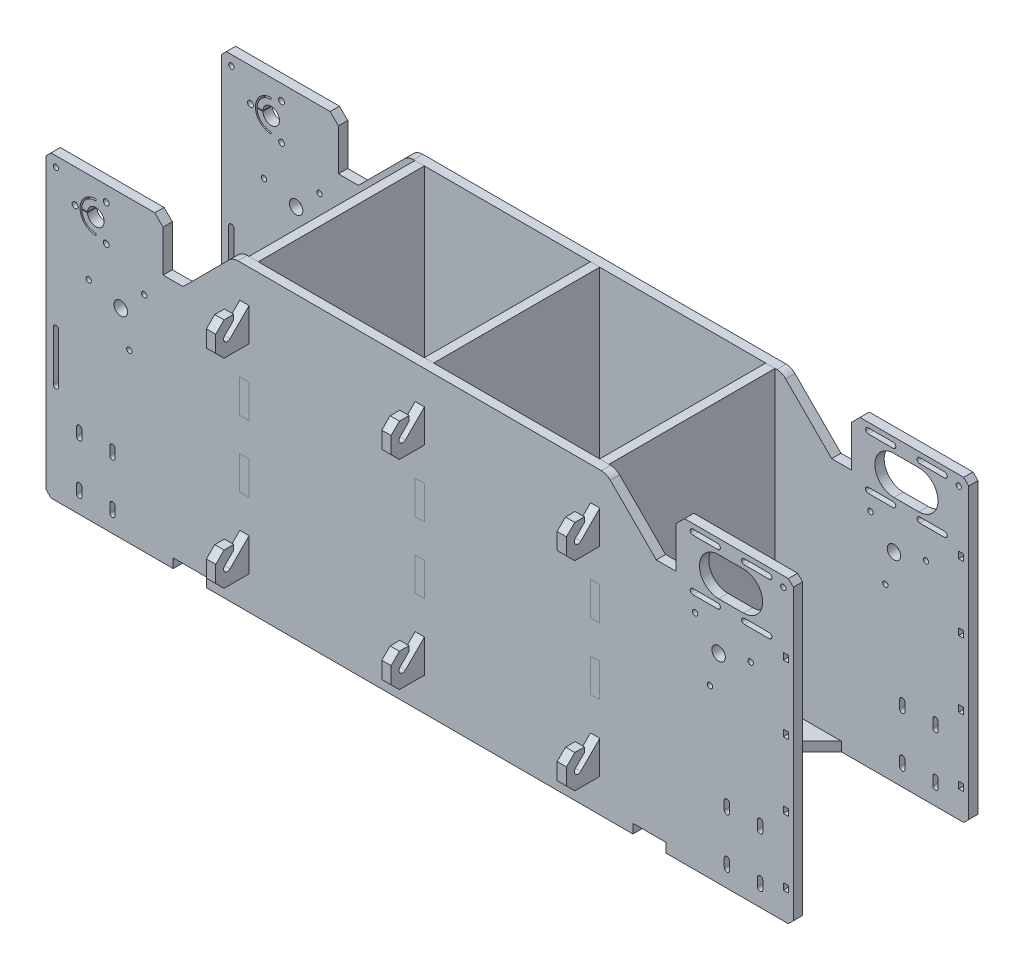
from build123d import *

# Parameters (mm, degrees)
SKETCH1_W           = 5.6
SKETCH1_H           = 20
BOSS_EXTRUDE1_DEPTH = 5.6
BOSS_EXTRUDE5_DEPTH = 5.6
CHAMFER1_SIZE       = 5
CUT_EXTRUDE1_DEPTH  = 7
LPATTERN2_COUNT     = 3
LPATTERN2_PITCH     = 105.6
BOSS_EXTRUDE6_DEPTH = 5.6
BOSS_EXTRUDE7_DEPTH = 5.6
SKETCH7_R           = 1.6
SKETCH7_R_2         = 4.1
SKETCH7_R_3         = 6.5
CUT_EXTRUDE3_DEPTH  = 5.6
LPATTERN4_COUNT     = 2
LPATTERN4_PITCH     = 105.6
CUT_EXTRUDE4_DEPTH  = 10
SKETCH14_R          = 1.75
CUT_EXTRUDE11_DEPTH = 5.6
CUT_EXTRUDE5_DEPTH  = 10
SKETCH10_R          = 4.05
SKETCH10_R_2        = 1.6
CUT_EXTRUDE6_DEPTH  = 10
SKETCH11_W          = 3
SKETCH11_H          = 4
CUT_EXTRUDE7_DEPTH  = 5.6
SKETCH12_R          = 1.6
CUT_EXTRUDE8_DEPTH  = 5.6
CHAMFER2_SIZE       = 3
CHAMFER3_SIZE       = 3
CUT_EXTRUDE9_DEPTH  = 5.6


with BuildPart() as part:
    # Sketch1 → Boss-Extrude1 (new body)
    with BuildSketch(Plane.XY):
        Polygon((0, 0), (76.6, 0), (76.6, 5.6), (96.6, 5.6), (96.6, 0), (353.4, 0), (353.4, 5.6), (373.4, 5.6), (373.4, 0), (450, 0), (450, 180), (0, 180), align=None)
        with Locations((330.6, 150)):
            Rectangle(SKETCH1_W, SKETCH1_H, mode=Mode.SUBTRACT)
        with Locations((330.6, 110)):
            Rectangle(SKETCH1_W, SKETCH1_H, mode=Mode.SUBTRACT)
        with Locations((330.6, 70)):
            Rectangle(SKETCH1_W, SKETCH1_H, mode=Mode.SUBTRACT)
        with Locations((330.6, 30)):
            Rectangle(SKETCH1_W, SKETCH1_H, mode=Mode.SUBTRACT)
        with Locations((119.4, 30)):
            Rectangle(SKETCH1_W, SKETCH1_H, mode=Mode.SUBTRACT)
        with Locations((119.4, 70)):
            Rectangle(SKETCH1_W, SKETCH1_H, mode=Mode.SUBTRACT)
        with Locations((119.4, 110)):
            Rectangle(SKETCH1_W, SKETCH1_H, mode=Mode.SUBTRACT)
        with Locations((119.4, 150)):
            Rectangle(SKETCH1_W, SKETCH1_H, mode=Mode.SUBTRACT)
        with Locations((225, 150)):
            Rectangle(SKETCH1_W, SKETCH1_H, mode=Mode.SUBTRACT)
        with Locations((225, 110)):
            Rectangle(SKETCH1_W, SKETCH1_H, mode=Mode.SUBTRACT)
        with Locations((225, 70)):
            Rectangle(SKETCH1_W, SKETCH1_H, mode=Mode.SUBTRACT)
        with Locations((225, 30)):
            Rectangle(SKETCH1_W, SKETCH1_H, mode=Mode.SUBTRACT)
    extrude(amount=BOSS_EXTRUDE1_DEPTH)

    # Sketch8 → Cut-Extrude4 (cut)
    with BuildSketch(Plane.XY.offset(5.6)):
        with BuildLine():
            Line((420, 171.5), (405, 171.5))
            ThreePointArc((405, 171.5), (393.5, 160), (405, 148.5))
            Line((405, 148.5), (420, 148.5))
            ThreePointArc((420, 148.5), (431.5, 160), (420, 171.5))
        make_face()
        with BuildLine():
            Line((435.5, 146.1), (420.5, 146.1))
            ThreePointArc((420.5, 146.1), (418.9, 144.5), (420.5, 142.9))
            Line((420.5, 142.9), (435.5, 142.9))
            ThreePointArc((435.5, 142.9), (437.1, 144.5), (435.5, 146.1))
        make_face()
        with BuildLine():
            Line((435.5, 177.1), (420.5, 177.1))
            ThreePointArc((420.5, 177.1), (418.9, 175.5), (420.5, 173.9))
            Line((420.5, 173.9), (435.5, 173.9))
            ThreePointArc((435.5, 173.9), (437.1, 175.5), (435.5, 177.1))
        make_face()
        with BuildLine():
            Line((404.5, 177.1), (389.5, 177.1))
            ThreePointArc((389.5, 177.1), (387.9, 175.5), (389.5, 173.9))
            Line((389.5, 173.9), (404.5, 173.9))
            ThreePointArc((404.5, 173.9), (406.1, 175.5), (404.5, 177.1))
        make_face()
        with BuildLine():
            ThreePointArc((25.00625, 159.750078137), (35, 160), (25.00625, 160.249921863))
            ThreePointArc((25.00625, 160.249921863), (25.003125244, 160.249980465), (25, 160.25))
            Line((25, 160.25), (21.503677266, 160.25))
            ThreePointArc((21.503677266, 160.25), (24.078640359, 166.098155459), (30, 168.5))
            Line((30, 168.5), (30, 169.5))
            ThreePointArc((30, 169.5), (20.5, 160), (30, 150.5))
            Line((30, 150.5), (30, 151.5))
            ThreePointArc((30, 151.5), (24.078640359, 153.901844541), (21.503677266, 159.75))
            Line((21.503677266, 159.75), (25, 159.75))
            ThreePointArc((25, 159.75), (25.003125244, 159.750019535), (25.00625, 159.750078137))
        make_face()
        with BuildLine():
            Line((404.5, 142.9), (389.5, 142.9))
            ThreePointArc((389.5, 142.9), (387.9, 144.5), (389.5, 146.1))
            Line((389.5, 146.1), (404.5, 146.1))
            ThreePointArc((404.5, 146.1), (406.1, 144.5), (404.5, 142.9))
        make_face()
    extrude(amount=-CUT_EXTRUDE4_DEPTH, mode=Mode.SUBTRACT)

    # Sketch14 → Cut-Extrude11 (cut)
    with BuildSketch(Plane(origin=(0, 0, 0), x_dir=(-1, 0, 0), z_dir=(0, 0, -1))):
        with Locations((-17.5, 160)):
            Circle(SKETCH14_R)
        with Locations((-36.25, 149.174682453)):
            Circle(SKETCH14_R)
        with Locations((-36.25, 170.825317547)):
            Circle(SKETCH14_R)
    extrude(amount=-CUT_EXTRUDE11_DEPTH, mode=Mode.SUBTRACT)

    # Sketch9 → Cut-Extrude5 (cut)
    with BuildSketch(Plane(origin=(0, 0, 0), x_dir=(-1, 0, 0), z_dir=(0, 0, -1))):
        with BuildLine():
            Line((-384.5, 180), (-335.222391823, 180))
            Line((-335.222391823, 180), (-334.460765152, 180))
            ThreePointArc((-334.460765152, 180), (-337.371477018, 179.341328219), (-339.838266899, 177.661733101))
            Line((-339.838266899, 177.661733101), (-367.5, 150))
            Line((-367.5, 150), (-379.5, 150))
            Line((-379.5, 150), (-379.5, 175))
            Line((-379.5, 175), (-384.5, 180))
        make_face()
    cut_extrude5 = extrude(amount=-CUT_EXTRUDE5_DEPTH, mode=Mode.SUBTRACT)

    # Mirror4: Cut-Extrude5 across plane
    add(cut_extrude5.mirror(Plane.ZY.offset(-225)), mode=Mode.SUBTRACT)

    # Sketch10 → Cut-Extrude6 (cut)
    with BuildSketch(Plane(origin=(0, 0, 0), x_dir=(-1, 0, 0), z_dir=(0, 0, -1))):
        with Locations((-405, 120)):
            Circle(SKETCH10_R)
        with Locations((-390.857864376, 134.142135624)):
            Circle(SKETCH10_R_2)
        with Locations((-399.823619098, 100.681483474)):
            Circle(SKETCH10_R_2)
        with Locations((-424.318516526, 125.176380902)):
            Circle(SKETCH10_R_2)
    cut_extrude6 = extrude(amount=-CUT_EXTRUDE6_DEPTH, mode=Mode.SUBTRACT)

    # Sketch11 → Cut-Extrude7 (cut)
    with BuildSketch(Plane.XY.offset(5.6)):
        with Locations((445.5, 138)):
            Rectangle(SKETCH11_W, SKETCH11_H)
        with Locations((445.5, 98)):
            Rectangle(SKETCH11_W, SKETCH11_H)
        with Locations((445.5, 58)):
            Rectangle(SKETCH11_W, SKETCH11_H)
        with Locations((445.5, 18)):
            Rectangle(SKETCH11_W, SKETCH11_H)
    extrude(amount=-CUT_EXTRUDE7_DEPTH, mode=Mode.SUBTRACT)

    # Sketch12 → Cut-Extrude8 (cut)
    with BuildSketch(Plane.XY.offset(5.6)):
        with Locations((444, 174)):
            Circle(SKETCH12_R)
        with Locations((6, 174)):
            Circle(SKETCH12_R)
        with BuildLine():
            Line((7.6, 90), (7.6, 60))
            ThreePointArc((7.6, 60), (6, 58.4), (4.4, 60))
            Line((4.4, 60), (4.4, 90))
            ThreePointArc((4.4, 90), (6, 91.6), (7.6, 90))
        make_face()
    extrude(amount=-CUT_EXTRUDE8_DEPTH, mode=Mode.SUBTRACT)

    # Chamfer2
    chamfer2_edges = [part.edges().sort_by_distance(p)[0] for p in [
        (450, 180, 2.8),
        (0, 180, 2.8),
    ]]
    chamfer(chamfer2_edges, length=CHAMFER2_SIZE)

    # Chamfer3
    chamfer3_edges = [part.edges().sort_by_distance(p)[0] for p in [
        (450, 0, 2.8),
        (0, 0, 2.8),
    ]]
    chamfer(chamfer3_edges, length=CHAMFER3_SIZE)

    # Sketch13 → Cut-Extrude9 (cut)
    with BuildSketch(Plane(origin=(0, 0, 0), x_dir=(-1, 0, 0), z_dir=(0, 0, -1))):
        with BuildLine():
            Line((-431.6, 40), (-431.6, 45))
            ThreePointArc((-431.6, 45), (-430, 46.6), (-428.4, 45))
            Line((-428.4, 45), (-428.4, 40))
            ThreePointArc((-428.4, 40), (-430, 38.4), (-431.6, 40))
        make_face()
        with BuildLine():
            Line((-411.6, 40), (-411.6, 45))
            ThreePointArc((-411.6, 45), (-410, 46.6), (-408.4, 45))
            Line((-408.4, 45), (-408.4, 40))
            ThreePointArc((-408.4, 40), (-410, 38.4), (-411.6, 40))
        make_face()
        with BuildLine():
            Line((-411.6, 10), (-411.6, 15))
            ThreePointArc((-411.6, 15), (-410, 16.6), (-408.4, 15))
            Line((-408.4, 15), (-408.4, 10))
            ThreePointArc((-408.4, 10), (-410, 8.4), (-411.6, 10))
        make_face()
        with BuildLine():
            Line((-431.6, 10), (-431.6, 15))
            ThreePointArc((-431.6, 15), (-430, 16.6), (-428.4, 15))
            Line((-428.4, 15), (-428.4, 10))
            ThreePointArc((-428.4, 10), (-430, 8.4), (-431.6, 10))
        make_face()
        with BuildLine():
            Line((-18.4, 40), (-18.4, 45))
            ThreePointArc((-18.4, 45), (-20, 46.6), (-21.6, 45))
            Line((-21.6, 45), (-21.6, 40))
            ThreePointArc((-21.6, 40), (-20, 38.4), (-18.4, 40))
        make_face()
        with BuildLine():
            Line((-38.4, 40), (-38.4, 45))
            ThreePointArc((-38.4, 45), (-40, 46.6), (-41.6, 45))
            Line((-41.6, 45), (-41.6, 40))
            ThreePointArc((-41.6, 40), (-40, 38.4), (-38.4, 40))
        make_face()
        with BuildLine():
            Line((-38.4, 10), (-38.4, 15))
            ThreePointArc((-38.4, 15), (-40, 16.6), (-41.6, 15))
            Line((-41.6, 15), (-41.6, 10))
            ThreePointArc((-41.6, 10), (-40, 8.4), (-38.4, 10))
        make_face()
        with BuildLine():
            Line((-18.4, 10), (-18.4, 15))
            ThreePointArc((-18.4, 15), (-20, 16.6), (-21.6, 15))
            Line((-21.6, 15), (-21.6, 10))
            ThreePointArc((-21.6, 10), (-20, 8.4), (-18.4, 10))
        make_face()
    extrude(amount=-CUT_EXTRUDE9_DEPTH, mode=Mode.SUBTRACT)

    # Mirror8: Cut-Extrude6 across plane
    add(cut_extrude6.mirror(Plane.ZY.offset(-225)), mode=Mode.SUBTRACT)


with BuildPart() as body_2:
    # Sketch2 → Boss-Extrude5 (new body)
    with BuildSketch(Plane(origin=(116.6, 0, 0), x_dir=(0, 0, -1), z_dir=(1, 0, 0))):
        Polygon((-5.6, 180), (-105.6, 180), (-105.6, 160), (-131.2, 160), (-131.2, 140), (-105.6, 140), (-105.6, 120), (-111.2, 120), (-111.2, 100), (-105.6, 100), (-105.6, 80), (-111.2, 80), (-111.2, 60), (-105.6, 60), (-105.6, 40), (-131.2, 40), (-131.2, 20), (-105.6, 20), (-105.6, 0), (-87, 0), (-87, 5.6), (-67, 5.6), (-67, 0), (-45.6, 0), (-45.6, 5.6), (-25.6, 5.6), (-25.6, 0), (-5.6, 0), (-5.6, 20), (0, 20), (0, 40), (-5.6, 40), (-5.6, 60), (0, 60), (0, 80), (-5.6, 80), (-5.6, 100), (0, 100), (0, 120), (-5.6, 120), (-5.6, 140), (0, 140), (0, 160), (-5.6, 160), align=None)
    extrude(amount=BOSS_EXTRUDE5_DEPTH)

    # Chamfer1
    chamfer1_edges = [body_2.edges().sort_by_distance(p)[0] for p in [
        (119.4, 20, 131.2),
        (119.4, 40, 131.2),
        (119.4, 140, 131.2),
        (119.4, 160, 131.2),
    ]]
    chamfer(chamfer1_edges, length=CHAMFER1_SIZE)

    # Sketch3 → Cut-Extrude1 (cut)
    with BuildSketch(Plane.ZY.offset(-116.6)):
        with BuildLine():
            Line((125.790990258, 151.590990258), (120.381980515, 157))
            Line((120.381980515, 157), (120.381980515, 160))
            Line((120.381980515, 160), (111.018019485, 160))
            Line((111.018019485, 160), (122.609009742, 148.409009742))
            ThreePointArc((122.609009742, 148.409009742), (125.790990258, 148.409009742), (125.790990258, 151.590990258))
        make_face()
        with BuildLine():
            Line((125.790990258, 31.590990258), (120.381980515, 37))
            Line((120.381980515, 37), (120.381980515, 40))
            Line((120.381980515, 40), (111.018019485, 40))
            Line((111.018019485, 40), (122.609009742, 28.409009742))
            ThreePointArc((122.609009742, 28.409009742), (125.790990258, 28.409009742), (125.790990258, 31.590990258))
        make_face()
    extrude(amount=-CUT_EXTRUDE1_DEPTH, mode=Mode.SUBTRACT)


with BuildPart() as lpattern2_1:
    # LPattern2: pattern copy
    add(body_2.part.moved(Location(Vector(1, 0, 0) * (1 * LPATTERN2_PITCH))))


with BuildPart() as lpattern2_2:
    # LPattern2: pattern copy
    add(body_2.part.moved(Location(Vector(1, 0, 0) * (2 * LPATTERN2_PITCH))))


with BuildPart() as body_5:
    # Sketch4 → Boss-Extrude6 (new body)
    with BuildSketch(Plane.XZ):
        Polygon((116.6, 5.6), (96.6, 5.6), (96.6, 0), (76.6, 0), (76.6, 5.6), (116.6, 45.6), (119.4, 45.6), (119.4, 25.6), (116.6, 25.6), align=None)
    extrude(amount=-BOSS_EXTRUDE6_DEPTH)


with BuildPart() as body_6:
    # Mirror3: mirrored copy
    add(body_5.part.mirror(Plane.ZY.offset(-225)))


with BuildPart() as body_7:
    # Sketch5 → Boss-Extrude7 (new body)
    with BuildSketch(Plane.XZ):
        Polygon((122.2, 105.6), (122.2, 87), (119.4, 87), (119.4, 67), (122.2, 67), (122.2, 45.6), (119.4, 45.6), (119.4, 25.6), (122.2, 25.6), (122.2, 5.6), (222.2, 5.6), (222.2, 25.6), (225, 25.6), (225, 45.6), (222.2, 45.6), (222.2, 67), (225, 67), (225, 87), (222.2, 87), (222.2, 105.6), align=None)
    extrude(amount=-BOSS_EXTRUDE7_DEPTH)

    # Sketch7 → Cut-Extrude3 (cut)
    with BuildSketch(Plane.XZ):
        with Locations((195.2, 68.1)):
            Circle(SKETCH7_R)
        with Locations((172.2, 91.1)):
            Circle(SKETCH7_R)
        with Locations((183.025317547, 72.35)):
            Circle(SKETCH7_R)
        with Locations((195.2, 55.6)):
            Circle(SKETCH7_R_2)
        with Locations((161.374682453, 72.35)):
            Circle(SKETCH7_R)
        with Locations((206.025317547, 49.35)):
            Circle(SKETCH7_R)
        with Locations((184.374682453, 49.35)):
            Circle(SKETCH7_R)
        with Locations((172.2, 78.6)):
            Circle(SKETCH7_R_2)
        with Locations((172.2, 55.6)):
            Circle(SKETCH7_R_3)
    extrude(amount=-CUT_EXTRUDE3_DEPTH, mode=Mode.SUBTRACT)


with BuildPart() as lpattern4_1:
    # LPattern4: pattern copy
    add(body_7.part.moved(Location(Vector(1, 0, 0) * (1 * LPATTERN4_PITCH))))


with BuildPart() as body_9:
    # Mirror11: mirrored copy
    add(part.part.mirror(Plane.XY.offset(55.6)))


solid = Compound([part.part, body_2.part, lpattern2_1.part, lpattern2_2.part, body_5.part, body_6.part, body_7.part, lpattern4_1.part, body_9.part])
